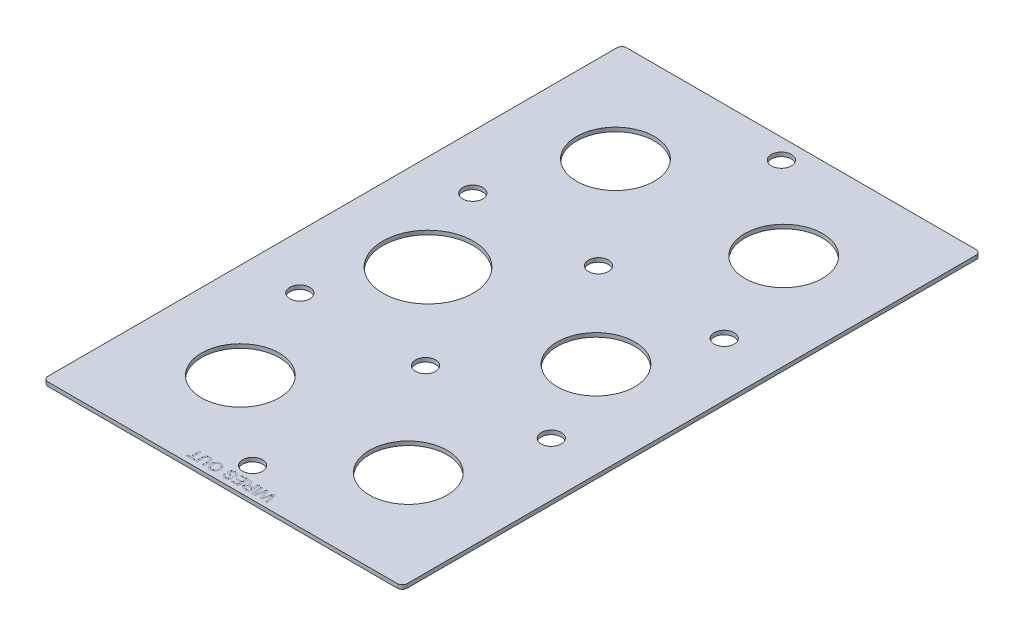
from build123d import *

# Parameters (mm, degrees)
SKETCH1_R           = 24.727
SKETCH1_R_2         = 28.76928198
SKETCH1_R_3         = 6.35
BOSS_EXTRUDE1_DEPTH = 2.54
SKETCH2_W           = 0.941716851
SKETCH2_H           = 6.677628581
CUT_EXTRUDE2_DEPTH  = 0.0254


with BuildPart() as part:
    # Sketch1 → Boss-Extrude1 (new body)
    with BuildSketch(Plane(origin=(0, 0, 0), x_dir=(1, 0, 0), z_dir=(0, 1, 0))):
        with BuildLine():
            Line((-111.125, 184.15), (111.125, 184.15))
            ThreePointArc((111.125, 184.15), (113.37006403, 183.22006403), (114.3, 180.975))
            Line((114.3, 180.975), (114.3, -180.975))
            ThreePointArc((114.3, -180.975), (113.37006403, -183.22006403), (111.125, -184.15))
            Line((111.125, -184.15), (-111.125, -184.15))
            ThreePointArc((-111.125, -184.15), (-113.37006403, -183.22006403), (-114.3, -180.975))
            Line((-114.3, -180.975), (-114.3, 180.975))
            ThreePointArc((-114.3, 180.975), (-113.37006403, 183.22006403), (-111.125, 184.15))
        make_face()
        with Locations((53.5178, -119.508581684)):
            Circle(SKETCH1_R, mode=Mode.SUBTRACT)
        with Locations((53.5178, -0.064290842)):
            Circle(SKETCH1_R, mode=Mode.SUBTRACT)
        with Locations((-53.5178, -119.38)):
            Circle(SKETCH1_R, mode=Mode.SUBTRACT)
        with Locations((-53.5178, 119.38)):
            Circle(SKETCH1_R, mode=Mode.SUBTRACT)
        with Locations((53.5178, 119.38)):
            Circle(SKETCH1_R, mode=Mode.SUBTRACT)
        with Locations((-53.5178, 0.064290842)):
            Circle(SKETCH1_R_2, mode=Mode.SUBTRACT)
        with Locations((0, -165.1)):
            Circle(SKETCH1_R_3, mode=Mode.SUBTRACT)
        with Locations((80.01, -55.0291)):
            Circle(SKETCH1_R_3, mode=Mode.SUBTRACT)
        with Locations((0, -55.033333333)):
            Circle(SKETCH1_R_3, mode=Mode.SUBTRACT)
        with Locations((-80.01, -55.0291)):
            Circle(SKETCH1_R_3, mode=Mode.SUBTRACT)
        with Locations((80.01, 55.0291)):
            Circle(SKETCH1_R_3, mode=Mode.SUBTRACT)
        with Locations((0, 55.033333333)):
            Circle(SKETCH1_R_3, mode=Mode.SUBTRACT)
        with Locations((-80.01, 55.0291)):
            Circle(SKETCH1_R_3, mode=Mode.SUBTRACT)
        with Locations((0, 171.45)):
            Circle(SKETCH1_R_3, mode=Mode.SUBTRACT)
    extrude(amount=BOSS_EXTRUDE1_DEPTH)

    # Sketch2 → Cut-Extrude2 (cut)
    # profile 1 of 8: a face of its own
    with BuildSketch(Plane(origin=(0, 2.54, 0), x_dir=(1, 0, 0), z_dir=(0, 1, 0))):
        with BuildLine():
            Line((23.632943238, -174.15), (25.314389377, -180.827628581))
            Line((25.314389377, -180.827628581), (24.341906208, -180.827628581))
            Line((24.341906208, -180.827628581), (23.350695716, -176.436071163))
            add(Edge.make_bspline(
                [(23.350695716, -176.436071163), (23.299325023, -176.209580808), (23.19710809, -175.758912379), (23.096001693, -175.307993508), (23.045707872, -175.083690855)],
                knots=[0, 0, 0, 0, 1.00513078, 2, 2, 2, 2], degree=3))
            add(Edge.make_bspline(
                [(23.045707872, -175.083690855), (23.021895326, -175.164344538), (22.976941578, -175.316603994), (22.916172822, -175.532446444), (22.860978508, -175.720827734), (22.813955785, -175.882626067), (22.775881668, -176.018068762), (22.743008908, -176.125491505), (22.720603246, -176.206997983), (22.70732561, -176.251932775), (22.701927715, -176.270200581)],
                knots=[0, 0, 0, 0, 1.633809233, 3.084334118, 4.356383392, 5.447555203, 6.357852567, 7.089694452, 7.629924063, 8, 8, 8, 8], degree=3))
            Line((22.701927715, -176.270200581), (21.382989057, -180.827628581))
            Line((21.382989057, -180.827628581), (20.24998597, -180.827628581))
            Line((20.24998597, -180.827628581), (19.296230125, -177.48212596))
            add(Edge.make_bspline(
                [(19.296230125, -177.48212596), (19.243596084, -177.27545393), (19.139813145, -176.867941413), (19.001920759, -176.260936424), (18.874650495, -175.668657498), (18.801340432, -175.276929476), (18.765176731, -175.083690855)],
                knots=[0, 0, 0, 0, 1.04154457, 2.053700482, 3.039894486, 4, 4, 4, 4], degree=3))
            add(Edge.make_bspline(
                [(18.765176731, -175.083690855), (18.742796194, -175.182212876), (18.695517606, -175.390339344), (18.622811501, -175.718808574), (18.540293141, -176.079224554), (18.484149649, -176.33036912), (18.454838223, -176.461486816)],
                knots=[0, 0, 0, 0, 0.858436457, 1.813435672, 2.858437265, 4, 4, 4, 4], degree=3))
            Line((18.454838223, -176.461486816), (17.468978394, -180.827628581))
            Line((17.468978394, -180.827628581), (16.496495226, -180.827628581))
            Line((16.496495226, -180.827628581), (18.179279031, -174.15))
            Line((18.179279031, -174.15), (19.214632501, -174.15))
            Line((19.214632501, -174.15), (20.609818119, -179.25319572))
            add(Edge.make_bspline(
                [(20.609818119, -179.25319572), (20.623827793, -179.303084201), (20.650440955, -179.397853738), (20.685324579, -179.53309308), (20.719917615, -179.652030516), (20.747432964, -179.756203119), (20.771245195, -179.844561153), (20.792331944, -179.916845919), (20.805894374, -179.974472146), (20.815702094, -180.00722518), (20.819831679, -180.021015994)],
                knots=[0, 0, 0, 0, 1.562239628, 2.967673567, 4.210417925, 5.296319877, 6.215971374, 6.969386481, 7.566055473, 8, 8, 8, 8], degree=3))
            add(Edge.make_bspline(
                [(20.819831679, -180.021015994), (20.844657297, -179.933580195), (20.891682413, -179.767957792), (20.960166786, -179.535091919), (21.019046174, -179.330752029), (21.055687775, -179.20458835), (21.072650549, -179.146182442)],
                knots=[0, 0, 0, 0, 1.197732026, 2.268764715, 3.198546125, 4, 4, 4, 4], degree=3))
            Line((21.072650549, -179.146182442), (22.518667475, -174.15))
            Line((22.518667475, -174.15), (23.632943238, -174.15))
        make_face()
    # profile 2 of 8: a face of its own
    with BuildSketch(Plane(origin=(0, 2.54, 0), x_dir=(1, 0, 0), z_dir=(0, 1, 0))):
        with Locations((15.340751818, -177.48881429)):
            Rectangle(SKETCH2_W, SKETCH2_H)
    # profile 3 of 8: a face of its own
    with BuildSketch(Plane(origin=(0, 2.54, 0), x_dir=(1, 0, 0), z_dir=(0, 1, 0))):
        with BuildLine():
            Line((13.328902181, -174.15), (13.328902181, -180.827628581))
            Line((13.328902181, -180.827628581), (10.431517665, -180.827628581))
            add(Edge.make_bspline(
                [(10.431517665, -180.827628581), (10.363292806, -180.827096546), (10.231251578, -180.826066856), (10.03976983, -180.818708935), (9.861463117, -180.803077027), (9.695207674, -180.785618097), (9.541287988, -180.759839646), (9.399630705, -180.729596873), (9.270779114, -180.693853433), (9.153752793, -180.651603204), (9.045169062, -180.603819062), (8.944548789, -180.544828573), (8.847571535, -180.480298913), (8.758103027, -180.403854788), (8.672113635, -180.32172384), (8.593203482, -180.229796624), (8.519037225, -180.130373993), (8.428860855, -179.986400185), (8.334151114, -179.793413553), (8.252576009, -179.548226002), (8.200705014, -179.29148519), (8.195105726, -179.116110271), (8.192264811, -179.027130169)],
                knots=[0, 0, 0, 0, 1.242075696, 2.40389213, 3.487198984, 4.500157661, 5.446319301, 6.326791195, 7.136300648, 7.878370406, 8.590488565, 9.292260633, 9.999224673, 10.708050372, 11.431369221, 12.162165018, 12.910600795, 13.687589445, 15.252257874, 16.810406251, 18.381693487, 20, 20, 20, 20], degree=3))
            add(Edge.make_bspline(
                [(8.192264811, -179.027130169), (8.193571517, -178.970008672), (8.19615235, -178.857189797), (8.215921505, -178.69131567), (8.251692958, -178.532830312), (8.297560289, -178.38034246), (8.360348032, -178.236024572), (8.433051662, -178.096884453), (8.523248176, -177.966910071), (8.623957418, -177.841757556), (8.741064038, -177.727074803), (8.871326311, -177.621080347), (9.018660448, -177.530119283), (9.178234156, -177.445586967), (9.354159906, -177.376163929), (9.54378457, -177.315034695), (9.748575738, -177.26790233), (9.890519546, -177.244161241), (9.963334571, -177.231982422)],
                knots=[0, 0, 0, 0, 0.982645791, 1.940792824, 2.867691729, 3.775150443, 4.675643875, 5.571354211, 6.471357401, 7.392684514, 8.331098131, 9.285922955, 10.275520706, 11.304845665, 12.388884831, 13.524255008, 14.729980297, 16, 16, 16, 16], degree=3))
            add(Edge.make_bspline(
                [(9.963334571, -177.231982422), (9.909404212, -177.205100634), (9.80713011, -177.154121729), (9.667956952, -177.069773388), (9.546035076, -176.990366643), (9.476778417, -176.93082278), (9.44432017, -176.90291659)],
                knots=[0, 0, 0, 0, 1.172551213, 2.223638478, 3.167479604, 4, 4, 4, 4], degree=3))
            add(Edge.make_bspline(
                [(9.44432017, -176.90291659), (9.381132019, -176.841164157), (9.251543527, -176.714520084), (9.074703105, -176.496807636), (8.899721615, -176.257386254), (8.794666383, -176.082915484), (8.740707864, -175.993303723)],
                knots=[0, 0, 0, 0, 0.918170575, 1.883016652, 2.912673989, 4, 4, 4, 4], degree=3))
            Line((8.740707864, -175.993303723), (7.645159425, -174.15))
            Line((7.645159425, -174.15), (8.724655872, -174.15))
            Line((8.724655872, -174.15), (9.556684113, -175.559899945))
            add(Edge.make_bspline(
                [(9.556684113, -175.559899945), (9.586601501, -175.609366751), (9.644576487, -175.705225299), (9.728289267, -175.845242248), (9.810477346, -175.974077121), (9.886334988, -176.09574056), (9.960672974, -176.20702405), (10.027312005, -176.312139162), (10.094234973, -176.405131078), (10.171077393, -176.516850283), (10.264921144, -176.637638948), (10.374430167, -176.76172404), (10.475116427, -176.864510619), (10.602349215, -176.962582681), (10.760556516, -177.052377229), (10.893947832, -177.09497336), (10.958558061, -177.115605481)],
                knots=[0, 0, 0, 0, 1.130591283, 2.190900266, 3.190104209, 4.119071823, 4.994606968, 5.807262858, 6.55236009, 7.234593472, 8.459046683, 9.540234366, 10.471327768, 11.266723835, 12.676093724, 14, 14, 14, 14], degree=3))
            add(Edge.make_bspline(
                [(10.958558061, -177.115605481), (10.985700699, -177.120500221), (11.047668153, -177.131675059), (11.152888735, -177.138973364), (11.28037638, -177.146719538), (11.372768849, -177.14649384), (11.422728157, -177.146371799)],
                knots=[0, 0, 0, 0, 0.709978628, 1.620902492, 2.713552433, 4, 4, 4, 4], degree=3))
            Line((11.422728157, -177.146371799), (12.38718533, -177.146371799))
            Line((12.38718533, -177.146371799), (12.38718533, -174.15))
            Line((12.38718533, -174.15), (13.328902181, -174.15))
        make_face()
        with BuildLine():
            Line((12.38718533, -177.916867405), (10.598725912, -177.916867405))
            add(Edge.make_bspline(
                [(10.598725912, -177.916867405), (10.509041729, -177.918258399), (10.341385561, -177.920858734), (10.10700453, -177.943403287), (9.906514669, -177.978643655), (9.737355011, -178.032167838), (9.595192811, -178.10384728), (9.4719805, -178.191504301), (9.368380463, -178.300253453), (9.28317838, -178.424950494), (9.216573602, -178.560844399), (9.170033561, -178.704671415), (9.138788207, -178.853673587), (9.135593421, -178.955629033), (9.133981662, -179.00706518)],
                knots=[0, 0, 0, 0, 1.546056516, 2.890207646, 4.055830773, 5.050253158, 5.937355789, 6.790906573, 7.644595853, 8.512568064, 9.38593768, 10.244184789, 11.114197691, 12, 12, 12, 12], degree=3))
            add(Edge.make_bspline(
                [(9.133981662, -179.00706518), (9.135218998, -179.044549755), (9.137642576, -179.117971028), (9.150482994, -179.225697904), (9.174913004, -179.327786542), (9.208647521, -179.424972845), (9.251360342, -179.51746782), (9.303847642, -179.604907678), (9.36583859, -179.686845812), (9.436949475, -179.763685608), (9.518568997, -179.833612923), (9.611805656, -179.893942185), (9.715914915, -179.945209834), (9.83102038, -179.985899051), (9.956758704, -180.018443865), (10.093845904, -180.040094864), (10.241654987, -180.055761459), (10.344078112, -180.056667262), (10.396738349, -180.057132975)],
                knots=[0, 0, 0, 0, 0.965235723, 1.89061323, 2.787065514, 3.661873922, 4.534873316, 5.404925039, 6.281839248, 7.175200054, 8.095223355, 9.040740021, 10.02630299, 11.075573487, 12.177989335, 13.364883635, 14.645170704, 16, 16, 16, 16], degree=3))
            Line((10.396738349, -180.057132975), (12.38718533, -180.057132975))
            Line((12.38718533, -180.057132975), (12.38718533, -177.916867405))
        make_face(mode=Mode.SUBTRACT)
    # profile 4 of 8: a face of its own
    with BuildSketch(Plane(origin=(0, 2.54, 0), x_dir=(1, 0, 0), z_dir=(0, 1, 0))):
        Polygon((6.6512736, -174.15), (6.6512736, -180.827628581), (1.942689345, -180.827628581), (1.942689345, -180.057132975), (5.709556749, -180.057132975), (5.709556749, -178.002478027), (2.199521213, -178.002478027), (2.199521213, -177.231982422), (5.709556749, -177.231982422), (5.709556749, -174.920495605), (1.771468099, -174.920495605), (1.771468099, -174.15), align=None)
    # profile 5 of 8: a face of its own
    with BuildSketch(Plane(origin=(0, 2.54, 0), x_dir=(1, 0, 0), z_dir=(0, 1, 0))):
        with BuildLine():
            Line((0.829751248, -176.461486816), (-0.111965603, -176.461486816))
            add(Edge.make_bspline(
                [(-0.111965603, -176.461486816), (-0.122300306, -176.376920767), (-0.142153826, -176.214464831), (-0.198105729, -175.984412505), (-0.268592025, -175.777033889), (-0.361338467, -175.592541821), (-0.475255133, -175.426545829), (-0.617782751, -175.279543528), (-0.788933822, -175.150501137), (-0.984673261, -175.040161916), (-1.198851792, -174.947216884), (-1.429578835, -174.882014332), (-1.673439367, -174.842475454), (-1.840524353, -174.837450703), (-1.925840675, -174.834884983)],
                knots=[0, 0, 0, 0, 1.125761249, 2.162647979, 3.12492346, 4.01623828, 4.884793378, 5.777219259, 6.711258599, 7.709587174, 8.742442187, 9.791331093, 10.872217593, 12, 12, 12, 12], degree=3))
            add(Edge.make_bspline(
                [(-1.925840675, -174.834884983), (-2.00132428, -174.836288662), (-2.148061054, -174.839017353), (-2.361175224, -174.871583172), (-2.561144255, -174.919761442), (-2.745807794, -174.989052862), (-2.911454681, -175.076152826), (-3.058487465, -175.175607161), (-3.180435603, -175.294131077), (-3.279079502, -175.425129954), (-3.35563269, -175.564239119), (-3.409002883, -175.707751543), (-3.444935193, -175.852872597), (-3.448840901, -175.951184835), (-3.450779894, -175.999992053)],
                knots=[0, 0, 0, 0, 1.267544124, 2.464049433, 3.614542348, 4.719673496, 5.768837234, 6.754183997, 7.692231426, 8.612479311, 9.501217876, 10.350240008, 11.180974857, 12, 12, 12, 12], degree=3))
            add(Edge.make_bspline(
                [(-3.450779894, -175.999992053), (-3.448734217, -176.048320403), (-3.444731839, -176.14287513), (-3.41298182, -176.279749764), (-3.361676939, -176.407107787), (-3.289708786, -176.526035669), (-3.191897669, -176.63581424), (-3.065416139, -176.733264907), (-2.913787566, -176.825956174), (-2.799626619, -176.875388546), (-2.739141591, -176.901578924)],
                knots=[0, 0, 0, 0, 0.942081658, 1.843188798, 2.725198023, 3.611401405, 4.541884661, 5.575766242, 6.715586633, 8, 8, 8, 8], degree=3))
            add(Edge.make_bspline(
                [(-2.739141591, -176.901578924), (-2.715616019, -176.911233178), (-2.662467478, -176.933043891), (-2.571372485, -176.961914532), (-2.463281361, -176.99926362), (-2.335982467, -177.037529049), (-2.189343903, -177.07852873), (-2.02471077, -177.125712807), (-1.840776969, -177.174847595), (-1.643984004, -177.226863987), (-1.444785638, -177.279623623), (-1.254502177, -177.333569336), (-1.078352587, -177.384734389), (-0.917007378, -177.437320494), (-0.770312038, -177.489221233), (-0.637865794, -177.540101227), (-0.519433039, -177.58869434), (-0.447100591, -177.624431007), (-0.412940449, -177.641308212)],
                knots=[0, 0, 0, 0, 0.499208779, 1.12780332, 1.87546358, 2.745246929, 3.737578632, 4.865834649, 6.108484299, 7.476352792, 8.863398792, 10.155242256, 11.360521946, 12.465428895, 13.487415091, 14.415997097, 15.251929613, 16, 16, 16, 16], degree=3))
            add(Edge.make_bspline(
                [(-0.412940449, -177.641308212), (-0.33439709, -177.683817677), (-0.182787966, -177.765872006), (0.022051427, -177.911714273), (0.19175084, -178.076704186), (0.331696087, -178.254473096), (0.439742994, -178.445942272), (0.516080243, -178.649014609), (0.565656107, -178.862897826), (0.570471317, -179.009909024), (0.572919379, -179.084649807)],
                knots=[0, 0, 0, 0, 1.158956011, 2.237086722, 3.252429106, 4.221720014, 5.165272549, 6.094237939, 7.031106807, 8, 8, 8, 8], degree=3))
            add(Edge.make_bspline(
                [(0.572919379, -179.084649807), (0.5697455, -179.167437968), (0.563432677, -179.332103021), (0.507294577, -179.573691375), (0.417883054, -179.80692136), (0.314888491, -179.991512006), (0.215916434, -180.131668806), (0.132735448, -180.231049213), (0.04094839, -180.323472006), (-0.057437483, -180.410854779), (-0.165974497, -180.489930177), (-0.281411584, -180.563343203), (-0.406113443, -180.62912905), (-0.582665272, -180.709334226), (-0.817493636, -180.791565656), (-1.113162554, -180.862810202), (-1.424366052, -180.904515975), (-1.636779572, -180.910290332), (-1.745255767, -180.913239204)],
                knots=[0, 0, 0, 0, 1.200056028, 2.386902731, 3.579012093, 4.815906327, 5.442508847, 6.067203999, 6.694073756, 7.331409728, 7.974631341, 8.640655778, 9.315145047, 10.018831381, 11.453504181, 12.917815188, 14.425977399, 16, 16, 16, 16], degree=3))
            add(Edge.make_bspline(
                [(-1.745255767, -180.913239204), (-1.864008344, -180.910604036), (-2.094800286, -180.905482671), (-2.430387838, -180.860316752), (-2.744325301, -180.787538362), (-2.990076794, -180.701794803), (-3.172239093, -180.616566745), (-3.300639933, -180.547887436), (-3.420230957, -180.470485202), (-3.533294276, -180.38853061), (-3.635789241, -180.296685259), (-3.731948999, -180.199779443), (-3.820155827, -180.095945122), (-3.924903958, -179.947643741), (-4.03554884, -179.749311317), (-4.135470952, -179.494928517), (-4.199457348, -179.224452318), (-4.213925457, -179.038607284), (-4.221275499, -178.944194878)],
                knots=[0, 0, 0, 0, 1.607451709, 3.124032445, 4.575401297, 5.965664223, 6.638286369, 7.297495781, 7.935629741, 8.566004073, 9.186263309, 9.796807256, 10.413736732, 11.028594479, 12.253110936, 13.478624344, 14.719098735, 16, 16, 16, 16], degree=3))
            Line((-4.221275499, -178.944194878), (-3.279558648, -178.944194878))
            add(Edge.make_bspline(
                [(-3.279558648, -178.944194878), (-3.273771602, -178.992058718), (-3.262436422, -179.085810392), (-3.230636994, -179.220547909), (-3.192600267, -179.34710359), (-3.144232188, -179.464055068), (-3.086506247, -179.572436506), (-3.018033712, -179.671011758), (-2.94152464, -179.761646465), (-2.85513315, -179.842750037), (-2.758041884, -179.913975704), (-2.650230509, -179.975532482), (-2.532098757, -180.028145122), (-2.402500751, -180.068705316), (-2.26316937, -180.102387332), (-2.112501629, -180.126565121), (-1.951024251, -180.139089809), (-1.839803256, -180.141504216), (-1.782710414, -180.142743598)],
                knots=[0, 0, 0, 0, 1.074256797, 2.104164074, 3.082231143, 4.018364317, 4.921387537, 5.814946689, 6.689553043, 7.561782592, 8.450683137, 9.368204304, 10.325224224, 11.328240899, 12.391723181, 13.519579538, 14.726730929, 16, 16, 16, 16], degree=3))
            add(Edge.make_bspline(
                [(-1.782710414, -180.142743598), (-1.723364228, -180.142302171), (-1.608484606, -180.141447678), (-1.442447663, -180.125584388), (-1.288428272, -180.104200282), (-1.147375889, -180.0713749), (-1.017974289, -180.03275508), (-0.902493225, -179.980895859), (-0.798180298, -179.922436669), (-0.706937899, -179.85391263), (-0.62829401, -179.777943815), (-0.557710091, -179.699906863), (-0.500797494, -179.615719234), (-0.450683023, -179.530042614), (-0.415765366, -179.438320253), (-0.388355797, -179.344542703), (-0.371689275, -179.246649151), (-0.369774726, -179.180134121), (-0.368797472, -179.146182442)],
                knots=[0, 0, 0, 0, 1.464224776, 2.834379057, 4.11387117, 5.299348816, 6.406355048, 7.441191667, 8.417293255, 9.352838038, 10.248153785, 11.113750317, 11.944205591, 12.75240885, 13.557683963, 14.358962649, 15.162355132, 16, 16, 16, 16], degree=3))
            add(Edge.make_bspline(
                [(-0.368797472, -179.146182442), (-0.37123109, -179.088731061), (-0.375954518, -178.977223227), (-0.424187626, -178.818804208), (-0.498370483, -178.674395009), (-0.571452417, -178.5958227), (-0.608239683, -178.556271744)],
                knots=[0, 0, 0, 0, 1.050964922, 2.039826012, 3.013306874, 4, 4, 4, 4], degree=3))
            add(Edge.make_bspline(
                [(-0.608239683, -178.556271744), (-0.631429982, -178.536506065), (-0.682713897, -178.492795485), (-0.778135549, -178.434949737), (-0.89644413, -178.376503535), (-1.038430802, -178.318405591), (-1.203848303, -178.259938836), (-1.392443217, -178.199783733), (-1.605290389, -178.139729949), (-1.835341443, -178.082797028), (-2.06742145, -178.024340103), (-2.287668031, -177.966739864), (-2.490671798, -177.912911415), (-2.674095348, -177.856871264), (-2.840956873, -177.807716205), (-2.987948727, -177.755816054), (-3.11771171, -177.708717275), (-3.19717772, -177.675472738), (-3.234078005, -177.660035536)],
                knots=[0, 0, 0, 0, 0.523895407, 1.158562347, 1.913798076, 2.79478753, 3.797549825, 4.933675542, 6.202127117, 7.604032848, 9.013379355, 10.32225155, 11.523321485, 12.628397413, 13.623935419, 14.51727859, 15.311493772, 16, 16, 16, 16], degree=3))
            add(Edge.make_bspline(
                [(-3.234078005, -177.660035536), (-3.282099123, -177.637911246), (-3.376356532, -177.594484974), (-3.509729216, -177.520126565), (-3.634989015, -177.443572345), (-3.748235425, -177.359213657), (-3.855033152, -177.274742137), (-3.949935026, -177.183421237), (-4.03498244, -177.087399774), (-4.135724875, -176.955469781), (-4.239063497, -176.77739795), (-4.32785, -176.547252493), (-4.383388253, -176.301361326), (-4.389423008, -176.131824444), (-4.392496745, -176.045472696)],
                knots=[0, 0, 0, 0, 0.899363591, 1.76530001, 2.59691609, 3.395188894, 4.166615117, 4.912545108, 5.632755751, 6.347510175, 7.734752518, 9.118421309, 10.532299558, 12, 12, 12, 12], degree=3))
            add(Edge.make_bspline(
                [(-4.392496745, -176.045472696), (-4.38895673, -175.958216064), (-4.381910949, -175.784547011), (-4.323029718, -175.528939319), (-4.228552762, -175.281766988), (-4.119204846, -175.085674821), (-4.015428246, -174.935673965), (-3.928279472, -174.827851279), (-3.831628839, -174.728155207), (-3.727864782, -174.633458837), (-3.616178846, -174.54569683), (-3.495631673, -174.464832572), (-3.367489359, -174.390049501), (-3.184530779, -174.298819838), (-2.941241491, -174.204081688), (-2.632292045, -174.121909663), (-2.305506818, -174.073218795), (-2.081621479, -174.067373774), (-1.96730832, -174.064389377)],
                knots=[0, 0, 0, 0, 1.196987384, 2.382393894, 3.582009067, 4.820735309, 5.454243406, 6.085350439, 6.72189866, 7.359035515, 8.013098289, 8.67027723, 9.350744424, 10.048966745, 11.475869723, 12.9268444, 14.430883741, 16, 16, 16, 16], degree=3))
            add(Edge.make_bspline(
                [(-1.96730832, -174.064389377), (-1.894611976, -174.065066361), (-1.751765216, -174.06639662), (-1.542326645, -174.079585244), (-1.342192809, -174.103413354), (-1.150563024, -174.13099369), (-0.968341294, -174.172446252), (-0.794482035, -174.219218191), (-0.63057113, -174.277895171), (-0.474803619, -174.342452696), (-0.328605544, -174.418733963), (-0.188907253, -174.500489596), (-0.059089327, -174.594273292), (0.064694543, -174.693730246), (0.178709516, -174.804374285), (0.284274783, -174.923623433), (0.382537737, -175.051206702), (0.471756298, -175.18726202), (0.551403598, -175.330229329), (0.623106063, -175.477623704), (0.683111758, -175.630231372), (0.732561435, -175.787693563), (0.773039531, -175.949295471), (0.801901647, -176.116113556), (0.822853734, -176.28710129), (0.827438496, -176.403014962), (0.829751248, -176.461486816)],
                knots=[0, 0, 0, 0, 1.259929758, 2.475735005, 3.634725603, 4.752877801, 5.82919746, 6.871690464, 7.871395985, 8.84458164, 9.791640072, 10.727373556, 11.647336026, 12.564665335, 13.477425593, 14.397128332, 15.323044476, 16.266184727, 17.214251675, 18.157898412, 19.105082968, 20.053433368, 21.01687335, 21.990151059, 22.98614553, 24, 24, 24, 24], degree=3))
        make_face()
    # profile 6 of 8: a face of its own
    with BuildSketch(Plane(origin=(0, 2.54, 0), x_dir=(1, 0, 0), z_dir=(0, 1, 0))):
        with BuildLine():
            add(Edge.make_bspline(
                [(-7.902532281, -177.400528336), (-7.904868823, -177.534404113), (-7.909421457, -177.795254276), (-7.95145786, -178.175167661), (-8.020805874, -178.532189836), (-8.116201245, -178.867972316), (-8.243080235, -179.179982669), (-8.393628601, -179.472057602), (-8.576292795, -179.739113512), (-8.782691478, -179.984238191), (-9.013292565, -180.200926501), (-9.258801186, -180.393382006), (-9.5223022, -180.553911345), (-9.801356042, -180.686456), (-10.097149626, -180.78821986), (-10.408852094, -180.859463844), (-10.73613018, -180.905423132), (-10.959832408, -180.910596003), (-11.074138323, -180.913239204)],
                knots=[0, 0, 0, 0, 1.203593535, 2.345140965, 3.431924157, 4.471254512, 5.478692091, 6.45615896, 7.42038538, 8.382007041, 9.33218277, 10.260966195, 11.182476517, 12.100814648, 13.034113903, 13.98924309, 14.972556454, 16, 16, 16, 16], degree=3))
            add(Edge.make_bspline(
                [(-11.074138323, -180.913239204), (-11.149533304, -180.911934631), (-11.2992541, -180.909343985), (-11.521000104, -180.889238618), (-11.736781479, -180.854330091), (-11.946724691, -180.805766742), (-12.151139417, -180.744669011), (-12.349890712, -180.669209665), (-12.543296166, -180.580933857), (-12.72962409, -180.478335871), (-12.907551192, -180.362886619), (-13.076351255, -180.237786024), (-13.233401839, -180.100524933), (-13.379460856, -179.952925043), (-13.515657342, -179.795062251), (-13.637638745, -179.623988246), (-13.752624989, -179.445105922), (-13.853438417, -179.254308827), (-13.944828148, -179.05598128), (-14.021432258, -178.849263699), (-14.089271715, -178.637118639), (-14.144048276, -178.418228466), (-14.184879158, -178.191968662), (-14.216276445, -177.959965089), (-14.233230262, -177.720928323), (-14.236209714, -177.559734193), (-14.23771837, -177.478112963)],
                knots=[0, 0, 0, 0, 1.034176269, 2.053687022, 3.051235935, 4.030520976, 5.007759882, 5.975670013, 6.944584641, 7.921900115, 8.890679583, 9.85222947, 10.801660264, 11.7488817, 12.698942795, 13.658174729, 14.62880618, 15.613957309, 16.61577279, 17.622338666, 18.636016077, 19.670029534, 20.714984856, 21.788550191, 22.880224384, 24, 24, 24, 24], degree=3))
            add(Edge.make_bspline(
                [(-14.23771837, -177.478112963), (-14.23632704, -177.395147409), (-14.233578228, -177.231234652), (-14.214978638, -176.989085358), (-14.182274095, -176.753887669), (-14.138897087, -176.524940267), (-14.08077322, -176.302719774), (-14.011701935, -176.086589067), (-13.928156318, -175.877835469), (-13.833800806, -175.675955826), (-13.727037631, -175.483726737), (-13.609270434, -175.302492165), (-13.480416558, -175.133948118), (-13.342430464, -174.976024416), (-13.192553381, -174.831989944), (-13.031942973, -174.699700845), (-12.860927681, -174.579726304), (-12.680177856, -174.47135865), (-12.492581258, -174.376071154), (-12.300415691, -174.291863457), (-12.103454523, -174.223732216), (-11.904579332, -174.163302758), (-11.700828725, -174.119850893), (-11.494123972, -174.087472249), (-11.283166388, -174.068538825), (-11.141503927, -174.065779634), (-11.070125326, -174.064389377)],
                knots=[0, 0, 0, 0, 1.141458971, 2.255149016, 3.338763392, 4.407145747, 5.45911027, 6.497028761, 7.526847988, 8.550472592, 9.561035647, 10.549629976, 11.521388012, 12.477647518, 13.432134385, 14.377847498, 15.337760086, 16.303574593, 17.274809663, 18.230970776, 19.187525402, 20.140611526, 21.088808525, 22.051011914, 23.017975238, 24, 24, 24, 24], degree=3))
            add(Edge.make_bspline(
                [(-11.070125326, -174.064389377), (-10.993387527, -174.065578265), (-10.841389166, -174.067933154), (-10.616494071, -174.089614076), (-10.397937614, -174.12672926), (-10.184469546, -174.17331902), (-9.978465382, -174.238729636), (-9.778201489, -174.315799462), (-9.585162533, -174.409065442), (-9.398356806, -174.514423347), (-9.219457707, -174.63122805), (-9.052258186, -174.76060398), (-8.894291212, -174.8980082), (-8.750367804, -175.048767929), (-8.616177575, -175.208166885), (-8.492171182, -175.377588378), (-8.380100815, -175.557881087), (-8.280587519, -175.748080587), (-8.190852932, -175.943360022), (-8.115208666, -176.14361748), (-8.048743226, -176.345945631), (-7.995807462, -176.551579843), (-7.953624841, -176.760048878), (-7.92525991, -176.971005018), (-7.90477459, -177.184762669), (-7.903283479, -177.328244511), (-7.902532281, -177.400528336)],
                knots=[0, 0, 0, 0, 1.072846099, 2.125039441, 3.155166917, 4.171599398, 5.177324298, 6.174217088, 7.169783185, 8.172042761, 9.17156421, 10.154239632, 11.126115549, 12.096189878, 13.065322046, 14.038037562, 15.029377678, 16.03062832, 17.03785952, 18.032507603, 19.022297599, 20.014323703, 20.999862951, 21.994471951, 22.989647507, 24, 24, 24, 24], degree=3))
        make_face()
        with BuildLine():
            add(Edge.make_bspline(
                [(-8.844249132, -177.389827008), (-8.845691451, -177.293420401), (-8.848503871, -177.105434323), (-8.880709052, -176.831367712), (-8.929517803, -176.572745434), (-8.996992393, -176.328962695), (-9.0870792, -176.101811602), (-9.197220938, -175.890855955), (-9.32641992, -175.695098662), (-9.474608164, -175.516758173), (-9.637434381, -175.356495336), (-9.811433573, -175.216453044), (-9.996444093, -175.099676631), (-10.190016428, -175.002138022), (-10.394717097, -174.926984881), (-10.609565389, -174.873858343), (-10.83455709, -174.84069725), (-10.98796563, -174.836846543), (-11.066112328, -174.834884983)],
                knots=[0, 0, 0, 0, 1.215616022, 2.370365452, 3.475740397, 4.533490648, 5.5560781, 6.552384115, 7.530550651, 8.509299237, 9.471863928, 10.40830403, 11.321168121, 12.226759389, 13.137923578, 14.065605683, 15.014614662, 16, 16, 16, 16], degree=3))
            add(Edge.make_bspline(
                [(-11.066112328, -174.834884983), (-11.145584318, -174.83687414), (-11.301190252, -174.840768903), (-11.529564036, -174.873370577), (-11.746544715, -174.928873529), (-11.954282865, -175.002760558), (-12.149023112, -175.102643127), (-12.335318626, -175.219605429), (-12.508095682, -175.362528616), (-12.671577088, -175.523079607), (-12.818263713, -175.705554814), (-12.948207868, -175.905555052), (-13.054493607, -176.1255657), (-13.143154965, -176.36242268), (-13.21270247, -176.617612405), (-13.261322688, -176.891132636), (-13.291306379, -177.182262372), (-13.294408799, -177.382171822), (-13.296001519, -177.484801292)],
                knots=[0, 0, 0, 0, 0.976909331, 1.912785716, 2.828990727, 3.727421029, 4.617481149, 5.514840137, 6.426786422, 7.368873452, 8.327895072, 9.299698503, 10.295216142, 11.325792517, 12.405818789, 13.542541501, 14.738390493, 16, 16, 16, 16], degree=3))
            add(Edge.make_bspline(
                [(-13.296001519, -177.484801292), (-13.295432936, -177.550823356), (-13.294317582, -177.680334751), (-13.279546538, -177.871236025), (-13.260493814, -178.056199196), (-13.231485645, -178.234985502), (-13.191509057, -178.406854888), (-13.147220595, -178.573114569), (-13.091843858, -178.732336242), (-13.028995551, -178.885128244), (-12.958725969, -179.030764274), (-12.879266751, -179.167807016), (-12.79230587, -179.296711184), (-12.69694247, -179.41690135), (-12.595587364, -179.530074697), (-12.48501404, -179.633289023), (-12.367044024, -179.728597735), (-12.241662552, -179.815025805), (-12.110881776, -179.892718043), (-11.975365427, -179.959721399), (-11.835545168, -180.016527398), (-11.691564755, -180.061039592), (-11.544290507, -180.097788881), (-11.393367263, -180.125010337), (-11.237612443, -180.139281733), (-11.132575308, -180.141581356), (-11.079488987, -180.142743598)],
                knots=[0, 0, 0, 0, 1.220320263, 2.393826742, 3.538159925, 4.657606474, 5.739544833, 6.799495376, 7.837090465, 8.853610905, 9.852768056, 10.824163015, 11.779900663, 12.724912201, 13.658747054, 14.586045767, 15.518168864, 16.460299482, 17.399069918, 18.328125852, 19.252745725, 20.186143833, 21.111865538, 22.057883325, 23.018444021, 24, 24, 24, 24], degree=3))
            add(Edge.make_bspline(
                [(-11.079488987, -180.142743598), (-11.004461348, -180.141228359), (-10.855981652, -180.1382297), (-10.63802316, -180.105825669), (-10.427655857, -180.057041995), (-10.226347354, -179.986576448), (-10.031803252, -179.898111997), (-9.846262357, -179.787970392), (-9.668543877, -179.658461794), (-9.499403075, -179.510137272), (-9.341758209, -179.33901986), (-9.208411133, -179.137407891), (-9.096043603, -178.909968126), (-9.002212749, -178.657318896), (-8.930671151, -178.377491444), (-8.881226496, -178.071693578), (-8.850008279, -177.739601999), (-8.846217925, -177.509399341), (-8.844249132, -177.389827008)],
                knots=[0, 0, 0, 0, 0.895098135, 1.771399171, 2.624879489, 3.470001555, 4.31324378, 5.172350046, 6.041214072, 6.935108351, 7.854676913, 8.809932058, 9.809814619, 10.877726151, 12.02168834, 13.252153056, 14.572707754, 16, 16, 16, 16], degree=3))
        make_face(mode=Mode.SUBTRACT)
    # profile 7 of 8: a face of its own
    with BuildSketch(Plane(origin=(0, 2.54, 0), x_dir=(1, 0, 0), z_dir=(0, 1, 0))):
        with BuildLine():
            Line((-19.631187609, -180.827628581), (-20.57290446, -180.827628581))
            Line((-20.57290446, -180.827628581), (-20.57290446, -176.985851881))
            add(Edge.make_bspline(
                [(-20.57290446, -176.985851881), (-20.57192501, -176.904247803), (-20.570019001, -176.745446134), (-20.561299934, -176.513844826), (-20.54415202, -176.295138552), (-20.518473348, -176.090000395), (-20.487784822, -175.897160187), (-20.451529682, -175.717269216), (-20.405329106, -175.55048789), (-20.353471363, -175.394985437), (-20.291719256, -175.249391707), (-20.218696545, -175.111618347), (-20.134771499, -174.980800183), (-20.038997968, -174.857225143), (-19.932898092, -174.740142704), (-19.815223272, -174.630478973), (-19.68544541, -174.528992677), (-19.546855025, -174.431847255), (-19.395802439, -174.344969249), (-19.232620143, -174.270031887), (-19.058355179, -174.205574542), (-18.872159021, -174.153754817), (-18.674886182, -174.11415287), (-18.46682239, -174.084540645), (-18.247453126, -174.067036747), (-18.097362537, -174.065284902), (-18.020637767, -174.064389377)],
                knots=[0, 0, 0, 0, 1.311377147, 2.551942077, 3.723550895, 4.835332178, 5.873100029, 6.860965504, 7.782222652, 8.65229484, 9.493385443, 10.320318369, 11.155067733, 11.987723446, 12.829729107, 13.691560723, 14.568860379, 15.475173283, 16.409214366, 17.364531151, 18.357450607, 19.391849073, 20.466818896, 21.588529868, 22.767281177, 24, 24, 24, 24], degree=3))
            add(Edge.make_bspline(
                [(-18.020637767, -174.064389377), (-17.945707184, -174.065492015), (-17.799710789, -174.067640419), (-17.585767701, -174.082176993), (-17.382254078, -174.107912541), (-17.188586558, -174.141766855), (-17.005718965, -174.187263096), (-16.833869804, -174.243868508), (-16.671919216, -174.309157223), (-16.519670433, -174.383700079), (-16.379396063, -174.470427823), (-16.24748194, -174.563051281), (-16.127830338, -174.667424286), (-16.018137536, -174.779614763), (-15.918239724, -174.900544816), (-15.83009427, -175.03136773), (-15.750285309, -175.170207297), (-15.684045049, -175.320651617), (-15.62424082, -175.48122443), (-15.574119498, -175.655302144), (-15.531322211, -175.842884958), (-15.497280422, -176.044405986), (-15.468391974, -176.259786753), (-15.4511903, -176.48981222), (-15.438263826, -176.733332251), (-15.436944188, -176.900221793), (-15.43626709, -176.985851881)],
                knots=[0, 0, 0, 0, 1.193078897, 2.324621146, 3.412165798, 4.458033356, 5.453301711, 6.409727336, 7.336550967, 8.231923267, 9.10494906, 9.959977801, 10.795507141, 11.62892236, 12.456145611, 13.289107106, 14.138012467, 15.002334476, 15.903094886, 16.864671381, 17.884255983, 18.965082669, 20.117808422, 21.342986352, 22.636701193, 24, 24, 24, 24], degree=3))
            Line((-15.43626709, -176.985851881), (-15.43626709, -180.827628581))
            Line((-15.43626709, -180.827628581), (-16.377983941, -180.827628581))
            Line((-16.377983941, -180.827628581), (-16.377983941, -177.029994859))
            add(Edge.make_bspline(
                [(-16.377983941, -177.029994859), (-16.378599989, -176.960878857), (-16.379788662, -176.827518513), (-16.385973544, -176.634329382), (-16.398394308, -176.455057108), (-16.413559277, -176.289840836), (-16.434880425, -176.138922017), (-16.461682215, -176.002391193), (-16.491970659, -175.879457766), (-16.537132914, -175.735572257), (-16.613199955, -175.575582907), (-16.728413961, -175.40286909), (-16.876113894, -175.257836074), (-17.047245029, -175.134823308), (-17.242803501, -175.038882357), (-17.459346341, -174.969045107), (-17.69665151, -174.927224186), (-17.861727698, -174.922788629), (-17.947066138, -174.920495605)],
                knots=[0, 0, 0, 0, 1.090438201, 2.104016592, 3.048763244, 3.925116223, 4.720979001, 5.45216101, 6.119252661, 6.717681473, 7.82855347, 8.901677854, 9.976092604, 11.075141713, 12.213970494, 13.397440122, 14.654570346, 16, 16, 16, 16], degree=3))
            add(Edge.make_bspline(
                [(-17.947066138, -174.920495605), (-18.020230425, -174.921739968), (-18.161503258, -174.924142707), (-18.365209886, -174.943554154), (-18.551977222, -174.978859127), (-18.723679921, -175.024712746), (-18.87893292, -175.086197227), (-19.018851259, -175.16065566), (-19.139734436, -175.252153114), (-19.249111741, -175.354862262), (-19.341476202, -175.4798953), (-19.418659774, -175.628483569), (-19.485224023, -175.800749715), (-19.53973443, -175.99833113), (-19.579542333, -176.221466532), (-19.610641149, -176.468761079), (-19.626952591, -176.741288824), (-19.629735298, -176.930989177), (-19.631187609, -177.029994859)],
                knots=[0, 0, 0, 0, 1.111591514, 2.146370713, 3.104407205, 3.996889121, 4.842307775, 5.6365848, 6.396727704, 7.139400744, 7.909024799, 8.745519786, 9.676513234, 10.710427131, 11.854494362, 13.117490512, 14.495602074, 16, 16, 16, 16], degree=3))
            Line((-19.631187609, -177.029994859), (-19.631187609, -180.827628581))
        make_face()
    # profile 8 of 8: a face of its own
    with BuildSketch(Plane(origin=(0, 2.54, 0), x_dir=(1, 0, 0), z_dir=(0, 1, 0))):
        Polygon((-23.740497504, -174.15), (-23.740497504, -180.057132975), (-21.600231934, -180.057132975), (-21.600231934, -180.827628581), (-26.822479926, -180.827628581), (-26.822479926, -180.057132975), (-24.682214355, -180.057132975), (-24.682214355, -174.15), align=None)
    extrude(amount=-CUT_EXTRUDE2_DEPTH, mode=Mode.SUBTRACT)


solid = part.part
